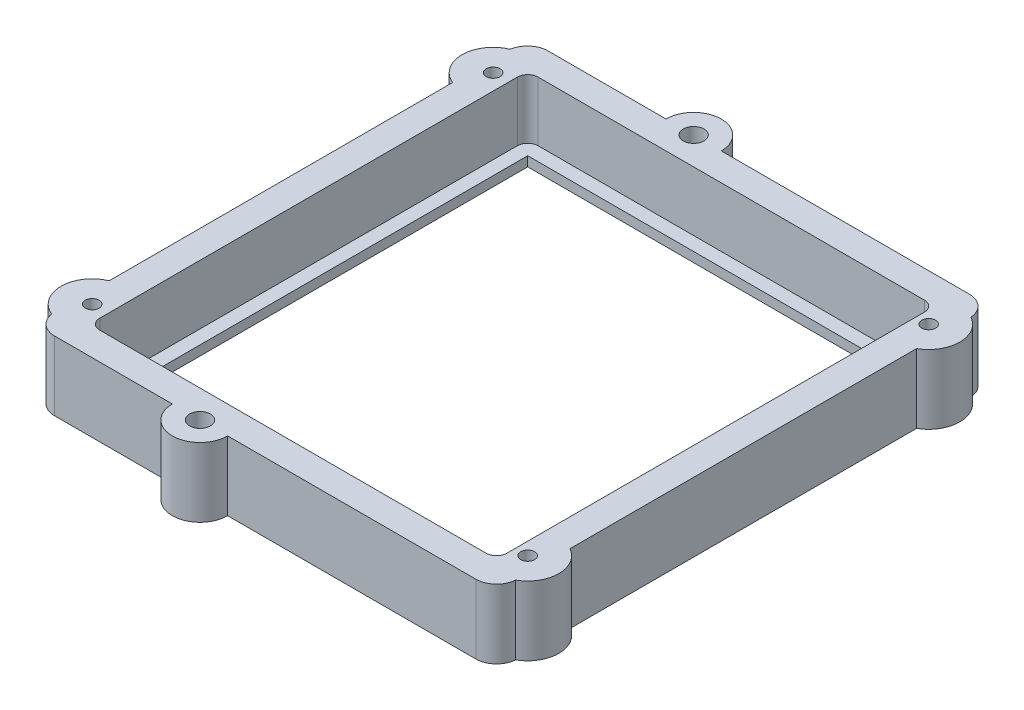
from build123d import *

# Parameters (mm, degrees)
SKETCH_1_R      = 1
SKETCH_1_R_2    = 1.5
EXTRUDE_1_DEPTH = 10
SKETCH_3_W      = 58.885714286
SKETCH_3_H      = 63.4
SKETCH_3_W_2    = 54.885714286
SKETCH_3_H_2    = 59.4
EXTRUDE_2_DEPTH = 1.4
FILLET_1_R      = 3


with BuildPart() as part:
    # Эскиз1 → Бобышка-Вытянуть1 (new body)
    with BuildSketch(Plane(origin=(0, 0, 0), x_dir=(1, 0, 0), z_dir=(0, 1, 0))):
        with BuildLine():
            Line((-4, 4), (16, 4))
            ThreePointArc((16, 4), (20, 8), (24, 4))
            Line((24, 4), (62.885714286, 4))
            Line((62.885714286, 4), (62.885714286, 1.233529339))
            ThreePointArc((62.885714286, 1.233529339), (65.2, -2.7), (62.885714286, -6.633529339))
            Line((62.885714286, -6.633529339), (62.885714286, -56.766470661))
            ThreePointArc((62.885714286, -56.766470661), (65.2, -60.7), (62.885714286, -64.633529339))
            Line((62.885714286, -64.633529339), (62.885714286, -67.4))
            Line((62.885714286, -67.4), (24, -67.4))
            ThreePointArc((24, -67.4), (20, -71.4), (16, -67.4))
            Line((16, -67.4), (-4, -67.4))
            Line((-4, -67.4), (-4, -64.866533331))
            ThreePointArc((-4, -64.866533331), (-6.8, -60.7), (-4, -56.533466669))
            Line((-4, -56.533466669), (-4, -6.866533331))
            ThreePointArc((-4, -6.866533331), (-6.8, -2.7), (-4, 1.466533331))
            Line((-4, 1.466533331), (-4, 4))
        make_face()
        with Locations(Location((-2.3, -2.7, 0), (0, 0, 270))):
            Circle(SKETCH_1_R, mode=Mode.SUBTRACT)
        with Locations(Location((60.7, -2.7, 0), (0, 0, 270))):
            Circle(SKETCH_1_R, mode=Mode.SUBTRACT)
        with Locations(Location((60.7, -60.7, 0), (0, 0, 270))):
            Circle(SKETCH_1_R, mode=Mode.SUBTRACT)
        with Locations(Location((-2.3, -60.7, 0), (0, 0, 270))):
            Circle(SKETCH_1_R, mode=Mode.SUBTRACT)
        with Locations(Location((20, -67.4, 0), (0, 0, 270))):
            Circle(SKETCH_1_R_2, mode=Mode.SUBTRACT)
        with Locations(Location((20, 4, 0), (0, 0, 270))):
            Circle(SKETCH_1_R_2, mode=Mode.SUBTRACT)
        with BuildLine():
            Line((1.5, 0), (57.385714286, 0))
            ThreePointArc((57.385714286, 0), (58.446374457, -0.439339828), (58.885714286, -1.5))
            Line((58.885714286, -1.5), (58.885714286, -61.9))
            ThreePointArc((58.885714286, -61.9), (58.446374457, -62.960660172), (57.385714286, -63.4))
            Line((57.385714286, -63.4), (1.5, -63.4))
            ThreePointArc((1.5, -63.4), (0.439339828, -62.960660172), (0, -61.9))
            Line((0, -61.9), (0, -1.5))
            ThreePointArc((0, -1.5), (0.439339828, -0.439339828), (1.5, 0))
        make_face(mode=Mode.SUBTRACT)
    extrude(amount=EXTRUDE_1_DEPTH)

    # Эскиз3 → Бобышка-Вытянуть2 (add)
    with BuildSketch(Plane.XZ):
        with Locations((29.442857143, 31.7)):
            Rectangle(SKETCH_3_W, SKETCH_3_H)
        with Locations((29.442857143, 31.7)):
            Rectangle(SKETCH_3_W_2, SKETCH_3_H_2, mode=Mode.SUBTRACT)
    extrude(amount=-EXTRUDE_2_DEPTH)

    # Скругление1
    # the kernel refuses this fillet: 3 mm, written as the material it takes off along each edge
    with BuildSketch(Plane(origin=(62.885714286, -7.477242159, 67.4), x_dir=(-1, 0, 0), z_dir=(0, 1, 0))) as fillet_1_piece_1:
        with BuildLine():
            CenterArc((2.990896863, -3), FILLET_1_R, 90, 85.535401485)
            Line((0, -2.766470661), (-0.059817937, -2.761800074))
            ThreePointArc((-0.059817937, -2.761800074), (-0.06, -1.38323533), (-0.06, 0))
            Line((-0.06, 0), (0, 0.06))
            Line((0, 0.06), (2.990896863, 0.06))
            Line((2.990896863, 0.06), (2.990896863, 0))
        make_face()
    extrude(amount=24.954484317, mode=Mode.SUBTRACT)
    with BuildSketch(Plane(origin=(-4, -7.408756074, 67.4), x_dir=(0, 0, -1), z_dir=(0, 1, 0))) as fillet_1_piece_2:
        with BuildLine():
            CenterArc((3, -2.96350243), FILLET_1_R, 98.946440174, 81.053559826)
            Line((0, -2.96350243), (-0.06, -2.96350243))
            Line((-0.06, -2.96350243), (-0.06, 0))
            Line((-0.06, 0), (0, 0.06))
            ThreePointArc((0, 0.06), (1.266733334, 0.06), (2.524136002, 0.059270049))
            Line((2.524136002, 0.059270049), (2.533466669, 0))
        make_face()
    extrude(amount=24.817512149, mode=Mode.SUBTRACT)
    with BuildSketch(Plane(origin=(62.885714286, -7.477242159, -4), x_dir=(-1, 0, 0), z_dir=(0, 1, 0))) as fillet_1_piece_3:
        with BuildLine():
            CenterArc((2.990896863, 3), FILLET_1_R, 184.464598515, 85.535401485)
            Line((0, 2.766470661), (-0.059817937, 2.761800074))
            ThreePointArc((-0.059817937, 2.761800074), (-0.06, 1.38323533), (-0.06, 0))
            Line((-0.06, 0), (0, -0.06))
            Line((0, -0.06), (2.990896863, -0.06))
            Line((2.990896863, -0.06), (2.990896863, 0))
        make_face()
    extrude(amount=24.954484317, mode=Mode.SUBTRACT)
    with BuildSketch(Plane(origin=(-4, -7.408756074, -4), x_dir=(0, 0, 1), z_dir=(0, 1, 0))) as fillet_1_piece_4:
        with BuildLine():
            CenterArc((3, 2.96350243), FILLET_1_R, 180, 81.053559826)
            Line((0, 2.96350243), (-0.06, 2.96350243))
            Line((-0.06, 2.96350243), (-0.06, 0))
            Line((-0.06, 0), (0, -0.06))
            ThreePointArc((0, -0.06), (1.266733334, -0.06), (2.524136002, -0.059270049))
            Line((2.524136002, -0.059270049), (2.533466669, 0))
        make_face()
    extrude(amount=24.817512149, mode=Mode.SUBTRACT)


solid = part.part
